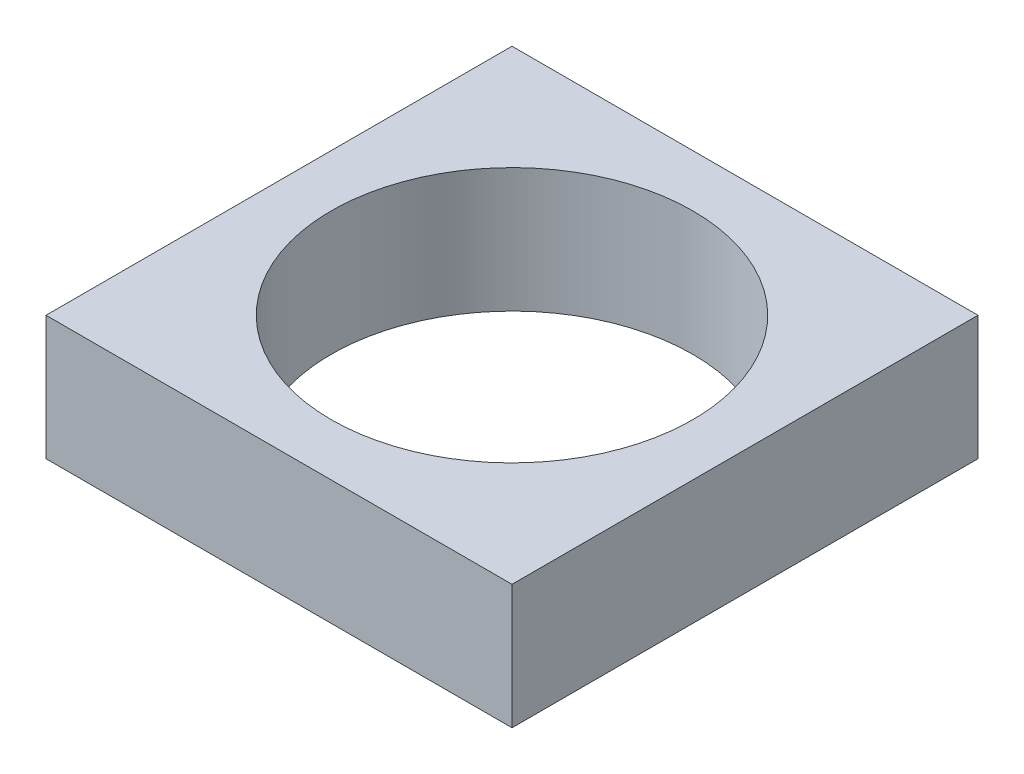
from build123d import *

# Parameters (mm, degrees)
SKETCH1_W           = 45
SKETCH1_H           = 45
SKETCH1_R           = 17.4625
BOSS_EXTRUDE1_DEPTH = 12


with BuildPart() as part:
    # Sketch1 → Boss-Extrude1 (new body)
    with BuildSketch(Plane(origin=(0, 0, 0), x_dir=(1, 0, 0), z_dir=(0, 1, 0))):
        Rectangle(SKETCH1_W, SKETCH1_H)
        Circle(SKETCH1_R, mode=Mode.SUBTRACT)
    extrude(amount=BOSS_EXTRUDE1_DEPTH)


solid = part.part
